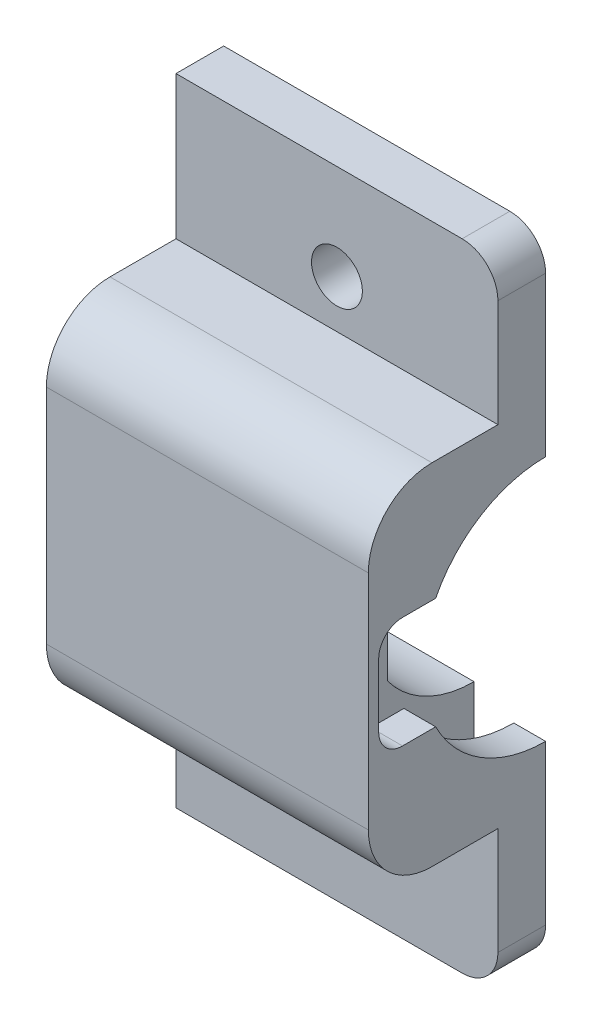
from build123d import *

# Parameters (mm, degrees)
SKETCH1_W           = 20.25
SKETCH1_H           = 40
BODY_DEPTH          = 3
SKETCH2_W           = 20.25
SKETCH2_H           = 22
HIROSE_DEPTH        = 8.15
SKETCH3_W           = 2
SKETCH3_H           = 7.75
SKETCH4_W           = 2.5
SKETCH4_H           = 20.5
HIROSE_MID_DEPTH    = 10.4
CUT_EXTRUDE2_DEPTH  = 2
FILLET1_R           = 1.5
SKETCH7_W           = 14
SKETCH7_H           = 6.75
BOSS_EXTRUDE3_START = 14
BOSS_EXTRUDE3_DEPTH = 14
FILLET2_R           = 3
FILLET3_R           = 4
SKETCH9_R           = 1.6
CUT_EXTRUDE3_DEPTH  = 46.568464973
FILLET4_R           = 2.25


with BuildPart() as part:
    # Sketch1 → body (new body)
    with BuildSketch(Plane.XY):
        with Locations((10.125, 20)):
            Rectangle(SKETCH1_W, SKETCH1_H)
    extrude(amount=BODY_DEPTH)

    # Sketch2 → hirose (add)
    with BuildSketch(Plane.XY.offset(3)):
        with Locations((10.125, 20)):
            Rectangle(SKETCH2_W, SKETCH2_H)
    extrude(amount=HIROSE_DEPTH)

    # Sketch3 → hirose-front (revolve, cut)
    with BuildSketch(Plane(origin=(0, 0, 0), x_dir=(-1, 0, 0), z_dir=(0, 0, -1))):
        with Locations((-19.25, 23.875)):
            Rectangle(SKETCH3_W, SKETCH3_H)
    revolve(axis=Axis((20.25, 20, 0), (-1, 0, 0)), mode=Mode.SUBTRACT)

    # Sketch4 → hirose-mid (cut)
    with BuildSketch(Plane(origin=(0, 0, 0), x_dir=(-1, 0, 0), z_dir=(0, 0, -1))):
        with Locations((-17, 20)):
            Rectangle(SKETCH4_W, SKETCH4_H)
    extrude(amount=-HIROSE_MID_DEPTH, mode=Mode.SUBTRACT)

    # Sketch5 → Cut-Extrude2 (cut)
    with BuildSketch(Plane(origin=(20.25, 0, 0), x_dir=(0, 0, -1), z_dir=(1, 0, 0))):
        with BuildLine():
            Line((-10.5, 16.5), (-10.5, 23.5))
            Line((-10.5, 23.5), (-6.914658343, 23.5))
            ThreePointArc((-6.914658343, 23.5), (-7.75, 20), (-6.914658343, 16.5))
            Line((-6.914658343, 16.5), (-10.5, 16.5))
        make_face()
    extrude(amount=-CUT_EXTRUDE2_DEPTH, mode=Mode.SUBTRACT)

    # Fillet1
    # the kernel refuses this fillet: 1.5 mm, written as the material it adds along each edge
    with BuildSketch(Plane(origin=(20.25, 23.5, 10.5), x_dir=(0, -1, 0), z_dir=(-1, 0, 0)), Plane(origin=(20.25, 16.5, 10.5), x_dir=(0, 0, -1), z_dir=(-1, 0, 0))) as fillet1_piece_1:
        with BuildLine():
            CenterArc((FILLET1_R, -FILLET1_R), FILLET1_R, 90, 90)
            Line((0, -FILLET1_R), (0, 0))
            Line((0, 0), (FILLET1_R, 0))
        make_face()
    extrude(amount=2)

    # Sketch7 → Cut-Revolve2 (revolve, cut)
    with BuildSketch(Plane(origin=(0, 0, 0), x_dir=(-1, 0, 0), z_dir=(0, 0, -1))):
        with Locations((-8.75, 23.375)):
            Rectangle(SKETCH7_W, SKETCH7_H)
    revolve(axis=Axis((15.75, 20, 0), (-1, 0, 0)), mode=Mode.SUBTRACT)

    # Sketch8 → Boss-Extrude3 (add)
    with BuildSketch(Plane(origin=(1.75, 0, 0), x_dir=(0, 0, -1), z_dir=(1, 0, 0)).offset(BOSS_EXTRUDE3_START)):
        with BuildLine():
            Line((-5.45, 23.98246155), (-5.45, 16.01753845))
            ThreePointArc((-5.45, 16.01753845), (-6.75, 20), (-5.45, 23.98246155))
        make_face()
    extrude(amount=-BOSS_EXTRUDE3_DEPTH)

    # Fillet2
    fillet2_edges = [part.edges().sort_by_distance(p)[0] for p in [
        (17, 9.75, 10.4),
        (17, 30.25, 10.4),
    ]]
    fillet(fillet2_edges, radius=FILLET2_R)

    # Fillet3
    fillet3_edges = [part.edges().sort_by_distance(p)[0] for p in [
        (10.125, 9, 11.15),
        (10.125, 31, 11.15),
    ]]
    fillet(fillet3_edges, radius=FILLET3_R)

    # Sketch9 → Cut-Extrude3 (cut, through all)
    with BuildSketch(Plane.XY.offset(3)):
        with Locations((10.125, 34)):
            Circle(SKETCH9_R)
        with Locations((10.125, 6)):
            Circle(SKETCH9_R)
    extrude(amount=-CUT_EXTRUDE3_DEPTH, mode=Mode.SUBTRACT)

    # Fillet4
    fillet4_edges = [part.edges().sort_by_distance(p)[0] for p in [
        (20.25, 40, 1.5),
        (20.25, 0, 1.5),
    ]]
    fillet(fillet4_edges, radius=FILLET4_R)


solid = part.part
